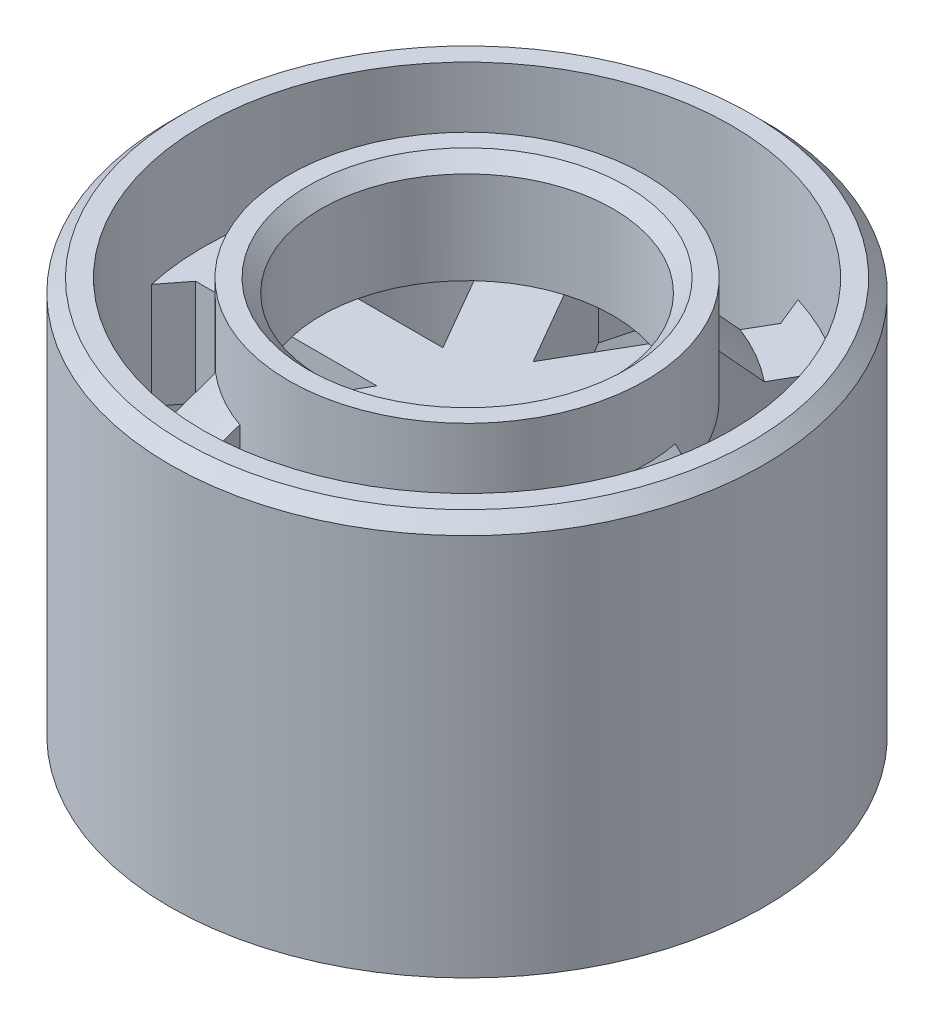
from build123d import *

# Parameters (mm, degrees)
SKETCH1_R               = 22.5
SKETCH1_R_2             = 20
BOSS_EXTRUDE1_DEPTH     = 30
BOSS_EXTRUDE2_DEPTH     = 4
CHAMFER1_SIZE           = 2
CHAMFER1_SIZE_2         = 1.79025908
CUT_EXTRUDE1_DEPTH      = 39.684622268
CUT_EXTRUDE1_DEPTH_BACK = 39.684622268
BOSS_EXTRUDE3_START     = -1.5
BOSS_EXTRUDE3_DEPTH     = 1.5
SKETCH6_R               = 13.5
SKETCH6_R_2             = 11.05
BOSS_EXTRUDE4_DEPTH     = 8
CHAMFER2_SIZE           = 1
CHAMFER3_SIZE           = 1
CHAMFER4_SIZE           = 2.5


with BuildPart() as part:
    # Sketch1 → Boss-Extrude1 (new body)
    with BuildSketch(Plane(origin=(0, 0, 0), x_dir=(1, 0, 0), z_dir=(0, 1, 0))):
        with Locations(Location((0, 0, 0), (0, 0, 270))):
            Circle(SKETCH1_R)
        with Locations(Location((0, 0, 0), (0, 0, 270))):
            Circle(SKETCH1_R_2, mode=Mode.SUBTRACT)
    extrude(amount=BOSS_EXTRUDE1_DEPTH)

    # Sketch2 → Boss-Extrude2 (add, symmetric)
    with BuildSketch(Plane(origin=(0, 18, 0), x_dir=(1, 0, 0), z_dir=(0, 1, 0))):
        with BuildLine():
            Line((-12.086630926, 15.934658856), (-4.330127019, 2.5))
            Line((-4.330127019, 2.5), (-19.843134833, 2.5))
            ThreePointArc((-19.843134833, 2.5), (-20, 0), (-19.843134833, -2.5))
            Line((-19.843134833, -2.5), (-4.330127019, -2.5))
            Line((-4.330127019, -2.5), (-12.086630926, -15.934658856))
            ThreePointArc((-12.086630926, -15.934658856), (-10, -17.320508076), (-7.756503907, -18.434658856))
            Line((-7.756503907, -18.434658856), (0, -5))
            Line((0, -5), (7.756503907, -18.434658856))
            ThreePointArc((7.756503907, -18.434658856), (10, -17.320508076), (12.086630926, -15.934658856))
            Line((12.086630926, -15.934658856), (4.330127019, -2.5))
            Line((4.330127019, -2.5), (19.843134833, -2.5))
            ThreePointArc((19.843134833, -2.5), (19.960745185, -1.252458251), (20, 0))
            ThreePointArc((20, 0), (19.960745185, 1.252458251), (19.843134833, 2.5))
            Line((19.843134833, 2.5), (4.330127019, 2.5))
            Line((4.330127019, 2.5), (12.086630926, 15.934658856))
            ThreePointArc((12.086630926, 15.934658856), (10, 17.320508076), (7.756503907, 18.434658856))
            Line((7.756503907, 18.434658856), (0, 5))
            Line((0, 5), (-7.756503907, 18.434658856))
            ThreePointArc((-7.756503907, 18.434658856), (-10, 17.320508076), (-12.086630926, 15.934658856))
        make_face()
    extrude(amount=BOSS_EXTRUDE2_DEPTH, both=True)

    # Chamfer1
    # the kernel refuses this chamfer: 2, 1.79025908 mm, written as the material it adds along each edge
    with BuildSketch(Plane(origin=(7.756503907, 22, 18.434658856), x_dir=(-0.9376749432180777, 0, 0.34751359809505994), z_dir=(0, -1, 0)), Plane(origin=(19.843134833, 22, 2.5), x_dir=(-0.16788186749818226, 0, 0.9858071203665161), z_dir=(0, -1, 0)), Plane(origin=(12.086630926, 22, -15.934658856), x_dir=(0.7697930757198956, 0, 0.6382935222714571), z_dir=(0, -1, 0)), Plane(origin=(-7.756503907, 22, -18.434658856), x_dir=(0.9376749432180783, 0, -0.34751359809505833), z_dir=(0, -1, 0)), Plane(origin=(-19.843134833, 22, -2.5), x_dir=(0.1678818674981782, 0, -0.9858071203665167), z_dir=(0, -1, 0)), Plane(origin=(-12.086630926, 22, 15.934658856), x_dir=(-0.7697930757198955, 0, -0.6382935222714572), z_dir=(0, -1, 0))) as chamfer1_piece_1:
        with BuildLine():
            Line((1.733569464, 0), (CHAMFER1_SIZE * 0.167881867498, CHAMFER1_SIZE * 0.985807120367))
            Line((CHAMFER1_SIZE * 0.167881867498, CHAMFER1_SIZE * 0.985807120367), (0, 0))
            ThreePointArc((0, 0), (0.889903139, -0.018778361), (1.733569464, 0))
        make_face()
    extrude(amount=8)
    with BuildSketch(Plane(origin=(12.086630926, 14, 15.934658856), x_dir=(0.7669529363679002, 0, -0.6417033531131466), z_dir=(0, 1, 0)), Plane(origin=(19.843134833, 14, -2.5), x_dir=(-0.17225493730569186, 0, -0.9850524029582447), z_dir=(0, 1, 0)), Plane(origin=(7.756503907, 14, -18.434658856), x_dir=(-0.9392078736735914, 0, -0.3433490498450975), z_dir=(0, 1, 0)), Plane(origin=(-12.086630926, 14, -15.934658856), x_dir=(-0.766952936367899, 0, 0.641703353113148), z_dir=(0, 1, 0)), Plane(origin=(-19.843134833, 14, 2.5), x_dir=(0.17225493730568892, 0, 0.9850524029582453), z_dir=(0, 1, 0)), Plane(origin=(-7.756503907, 14, 18.434658856), x_dir=(0.9392078736735913, 0, 0.3433490498450977), z_dir=(0, 1, 0))) as chamfer1_piece_2:
        with BuildLine():
            Line((1.910893878, 0), (CHAMFER1_SIZE_2 * 0.172254937261, CHAMFER1_SIZE_2 * 0.985052402702))
            Line((CHAMFER1_SIZE_2 * 0.172254937261, CHAMFER1_SIZE_2 * 0.985052402702), (0, 0))
            ThreePointArc((0, 0), (0.982338586, -0.022816928), (1.910893878, 0))
        make_face()
    extrude(amount=8)

    # Sketch4 → Cut-Extrude1 (cut, two sides: drawn at the far end of the back side and taken through both)
    with BuildSketch(Plane(origin=(0, 22, 0), x_dir=(1, 0, 0), z_dir=(0, 1, 0)).offset(-CUT_EXTRUDE1_DEPTH_BACK)):
        with BuildLine():
            Line((-1.09656677, 1.165135752), (-1.097544149, 0.833904576))
            Line((-1.097544149, 0.833904576), (-1.102446274, -0.827412964))
            Line((-1.102446274, -0.827412964), (-1.103423653, -1.15864414))
            ThreePointArc((-1.103423653, -1.15864414), (1.599993035, -0.004721172), (-1.09656677, 1.165135752))
        make_face()
    extrude(amount=CUT_EXTRUDE1_DEPTH + CUT_EXTRUDE1_DEPTH_BACK, mode=Mode.SUBTRACT)

    # Sketch5 → Boss-Extrude3 (add)
    with BuildSketch(Plane(origin=(0, 22, 0), x_dir=(1, 0, 0), z_dir=(0, 1, 0)).offset(BOSS_EXTRUDE3_START)):
        with BuildLine():
            Line((-1.09656677, 1.165135752), (-1.103423653, -1.15864414))
            ThreePointArc((-1.103423653, -1.15864414), (1.599993035, -0.004721172), (-1.09656677, 1.165135752))
        make_face()
    extrude(amount=BOSS_EXTRUDE3_DEPTH)

    # Sketch6 → Boss-Extrude4 (add)
    with BuildSketch(Plane(origin=(0, 22, 0), x_dir=(1, 0, 0), z_dir=(0, 1, 0))):
        with Locations(Location((0, 0, 0), (0, 0, 109.328070714))):
            Circle(SKETCH6_R)
        with Locations(Location((0, 0, 0), (0, 0, 73.076060846))):
            Circle(SKETCH6_R_2, mode=Mode.SUBTRACT)
    extrude(amount=BOSS_EXTRUDE4_DEPTH)

    # Chamfer2
    chamfer2_edges = [part.edges().sort_by_distance(p)[0] for p in [
        (0, 30, -22.5),
    ]]
    chamfer(chamfer2_edges, length=CHAMFER2_SIZE)

    # Chamfer3
    chamfer3_edges = [part.edges().sort_by_distance(p)[0] for p in [
        (-3.216676451, 30, 10.571447044),
    ]]
    chamfer(chamfer3_edges, length=CHAMFER3_SIZE)

    # Chamfer4
    # the kernel refuses this chamfer: 2.5 mm, written as the material it adds along each edge
    with BuildSketch(Plane(origin=(0, 22, 0), x_dir=(0.7884516512749685, 0, 0.6150967351577924), z_dir=(-0.6150967351577924, 0, 0.7884516512749685))) as chamfer4_piece_1_section:
        Polygon((13.5, CHAMFER4_SIZE), (13.5 + CHAMFER4_SIZE, 0), (13.5, 0), align=None)
    chamfer4_piece_1 = revolve(axis=Axis((0, 22, 0), (0, 1, 0)), revolution_arc=75.917899148, mode=Mode.PRIVATE)
    chamfer4_piece_1 = split(chamfer4_piece_1, bisect_by=Plane(origin=(0, 22, 2.5), z_dir=(0, 0, -1)), keep=Keep.TOP, mode=Mode.PRIVATE)
    chamfer4_piece_1 = split(chamfer4_piece_1, bisect_by=Plane(origin=(0, 22, -2.5), z_dir=(0, 0, 1)), keep=Keep.TOP, mode=Mode.PRIVATE)
    add(chamfer4_piece_1)
    with BuildSketch(Plane(origin=(0, 22, 0), x_dir=(0.9269152240690147, 0, -0.3752707920809829), z_dir=(0.3752707920809829, 0, 0.9269152240690147))) as chamfer4_piece_2_section:
        Polygon((13.5, CHAMFER4_SIZE), (13.5 + CHAMFER4_SIZE, 0), (13.5, 0), align=None)
    chamfer4_piece_2 = revolve(axis=Axis((0, 22, 0), (0, 1, 0)), revolution_arc=75.917899148, mode=Mode.PRIVATE)
    chamfer4_piece_2 = split(chamfer4_piece_2, bisect_by=Plane(origin=(2.165063509, 22, 1.25), z_dir=(-0.8660254037844385, 0, -0.5000000000000003)), keep=Keep.TOP, mode=Mode.PRIVATE)
    chamfer4_piece_2 = split(chamfer4_piece_2, bisect_by=Plane(origin=(-2.165063509, 22, -1.25), z_dir=(0.8660254037844383, 0, 0.5000000000000009)), keep=Keep.TOP, mode=Mode.PRIVATE)
    add(chamfer4_piece_2)
    with BuildSketch(Plane(origin=(0, 22, 0), x_dir=(0.138463572798161, 0, -0.9903675272382311), z_dir=(0.9903675272382311, 0, 0.138463572798161))) as chamfer4_piece_3_section:
        Polygon((13.5, CHAMFER4_SIZE), (13.5 + CHAMFER4_SIZE, 0), (13.5, 0), align=None)
    chamfer4_piece_3 = revolve(axis=Axis((0, 22, 0), (0, 1, 0)), revolution_arc=75.917899148, mode=Mode.PRIVATE)
    chamfer4_piece_3 = split(chamfer4_piece_3, bisect_by=Plane(origin=(-2.165063509, 22, 1.25), z_dir=(0.8660254037844393, 0, -0.49999999999999906)), keep=Keep.TOP, mode=Mode.PRIVATE)
    chamfer4_piece_3 = split(chamfer4_piece_3, bisect_by=Plane(origin=(2.165063509, 22, -1.25), z_dir=(-0.8660254037844392, 0, 0.49999999999999917)), keep=Keep.TOP, mode=Mode.PRIVATE)
    add(chamfer4_piece_3)
    with BuildSketch(Plane(origin=(0, 22, 0), x_dir=(-0.788451651274934, 0, -0.6150967351578366), z_dir=(0.6150967351578366, 0, -0.788451651274934))) as chamfer4_piece_4_section:
        Polygon((13.5, CHAMFER4_SIZE), (13.5 + CHAMFER4_SIZE, 0), (13.5, 0), align=None)
    chamfer4_piece_4 = revolve(axis=Axis((0, 22, 0), (0, 1, 0)), revolution_arc=75.917899148, mode=Mode.PRIVATE)
    chamfer4_piece_4 = split(chamfer4_piece_4, bisect_by=Plane(origin=(0, 22, -2.5), z_dir=(0, 0, 1)), keep=Keep.TOP, mode=Mode.PRIVATE)
    chamfer4_piece_4 = split(chamfer4_piece_4, bisect_by=Plane(origin=(0, 22, 2.5), z_dir=(0, 0, -1)), keep=Keep.TOP, mode=Mode.PRIVATE)
    add(chamfer4_piece_4)
    with BuildSketch(Plane(origin=(0, 22, 0), x_dir=(-0.9269152240690146, 0, 0.375270792080983), z_dir=(-0.375270792080983, 0, -0.9269152240690146))) as chamfer4_piece_5_section:
        Polygon((13.5, CHAMFER4_SIZE), (13.5 + CHAMFER4_SIZE, 0), (13.5, 0), align=None)
    chamfer4_piece_5 = revolve(axis=Axis((0, 22, 0), (0, 1, 0)), revolution_arc=75.917899148, mode=Mode.PRIVATE)
    chamfer4_piece_5 = split(chamfer4_piece_5, bisect_by=Plane(origin=(-2.165063509, 22, -1.25), z_dir=(0.8660254037844384, 0, 0.5000000000000006)), keep=Keep.TOP, mode=Mode.PRIVATE)
    chamfer4_piece_5 = split(chamfer4_piece_5, bisect_by=Plane(origin=(2.165063509, 22, 1.25), z_dir=(-0.8660254037844386, 0, -0.5000000000000003)), keep=Keep.TOP, mode=Mode.PRIVATE)
    add(chamfer4_piece_5)
    with BuildSketch(Plane(origin=(0, 22, 0), x_dir=(-0.13846357279405325, 0, 0.9903675272388054), z_dir=(-0.9903675272388054, 0, -0.13846357279405325))) as chamfer4_piece_6_section:
        Polygon((13.5, CHAMFER4_SIZE), (13.5 + CHAMFER4_SIZE, 0), (13.5, 0), align=None)
    chamfer4_piece_6 = revolve(axis=Axis((0, 22, 0), (0, 1, 0)), revolution_arc=75.917899148, mode=Mode.PRIVATE)
    chamfer4_piece_6 = split(chamfer4_piece_6, bisect_by=Plane(origin=(-2.165063509, 22, 1.25), z_dir=(0.8660254037844392, 0, -0.4999999999999992)), keep=Keep.TOP, mode=Mode.PRIVATE)
    chamfer4_piece_6 = split(chamfer4_piece_6, bisect_by=Plane(origin=(2.165063509, 22, -1.25), z_dir=(-0.866025403784439, 0, 0.4999999999999993)), keep=Keep.TOP, mode=Mode.PRIVATE)
    add(chamfer4_piece_6)


solid = part.part
